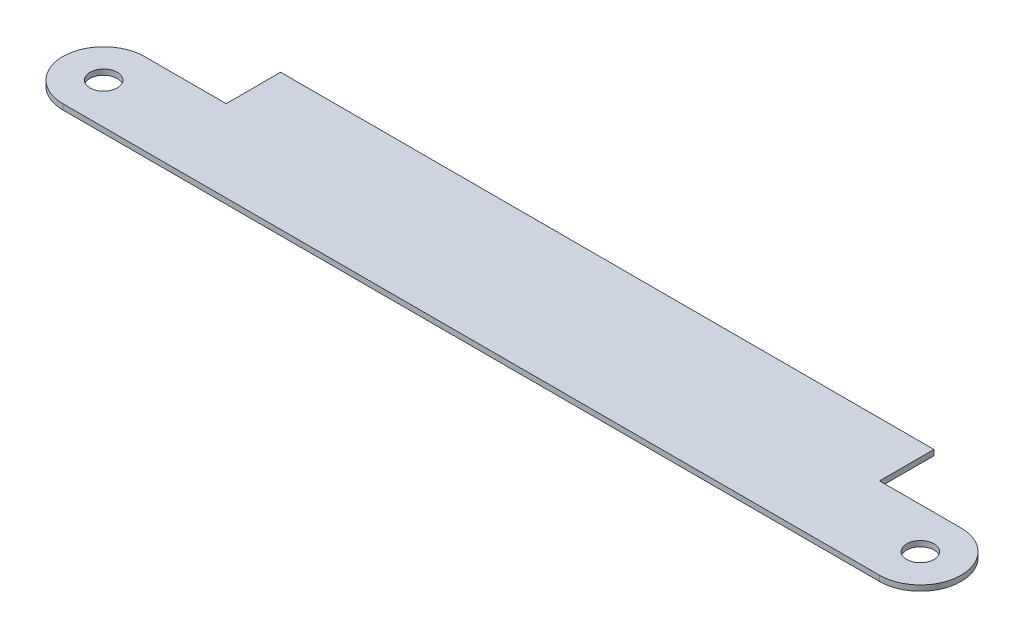
from build123d import *

# Parameters (mm, degrees)
SKETCH1_R           = 2.5
BOSS_EXTRUDE1_DEPTH = 1


with BuildPart() as part:
    # Sketch1 → Boss-Extrude1 (new body)
    with BuildSketch(Plane(origin=(0, 0, 0), x_dir=(1, 0, 0), z_dir=(0, 1, 0))):
        with BuildLine():
            Line((0, 7.5), (15, 7.5))
            Line((15, 7.5), (15, 17.5))
            Line((15, 17.5), (135, 17.5))
            Line((135, 17.5), (135, 7.5))
            Line((135, 7.5), (150, 7.5))
            ThreePointArc((150, 7.5), (157.5, 0), (150, -7.5))
            Line((150, -7.5), (0, -7.5))
            ThreePointArc((0, -7.5), (-7.5, 0), (0, 7.5))
        make_face()
        Circle(SKETCH1_R, mode=Mode.SUBTRACT)
        with Locations((150, 0)):
            Circle(SKETCH1_R, mode=Mode.SUBTRACT)
    extrude(amount=BOSS_EXTRUDE1_DEPTH)


solid = part.part
